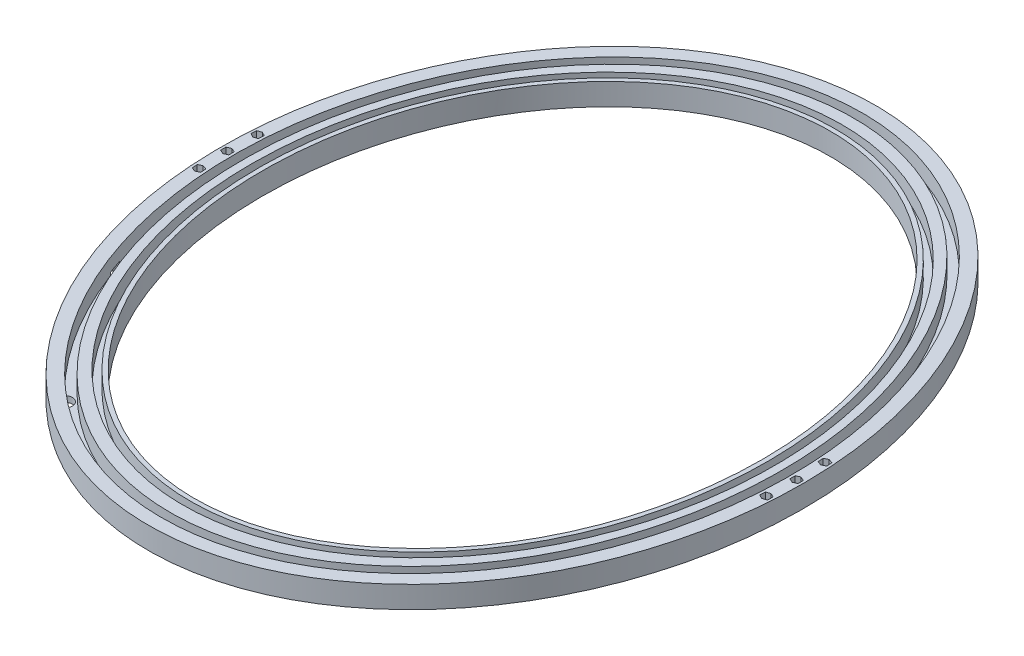
from build123d import *

# Parameters (mm, degrees)
BOSS_EXTRUDE1_DEPTH = 4
BOSS_EXTRUDE2_DEPTH = 11
BOSS_EXTRUDE3_DEPTH = 11
BOSS_EXTRUDE4_DEPTH = 11
SKETCH6_R           = 306.279665697
CUT_EXTRUDE1_DEPTH  = 652.769016328
CUT_EXTRUDE2_REACH  = 647.465
SKETCH7_R           = 1.6
CUT_EXTRUDE3_DEPTH  = 6
SKETCH10_R          = 5.05
SKETCH10_R_2        = 5.1
CUT_EXTRUDE5_DEPTH  = 6


# Read off the part's stored shape, not the designer's step: Boss-Extrude2, Boss-Extrude3, Boss-Extrude4
with BuildPart() as part:
    # Sketch1 → Boss-Extrude1 (new body)
    with BuildSketch(Plane(origin=(0, 0, 0), x_dir=(1, 0, 0), z_dir=(0, 1, 0))):
        with BuildLine():
            add(Edge.make_bspline(
                [(194.620385804, -441.419310901), (196.467552441, -434.101473588), (198.027915319, -426.761109931), (200.605339766, -412.03771026), (201.622280103, -404.654664724), (203.128308568, -389.84711471), (203.617238499, -382.422597806), (204.069983835, -367.53232008), (204.033621448, -360.066545294), (203.577995162, -348.836380993), (203.359198339, -345.087736705), (202.928541561, -339.456722665), (202.767716017, -337.576445109), (202.412736876, -333.825137098), (202.218627329, -331.953928435), (201.165418973, -322.619994341), (200.058567787, -315.223535194), (197.320407538, -300.570893555), (195.688759817, -293.314801644), (191.892155974, -278.945261725), (189.726808976, -271.831918264), (184.840221992, -257.753915941), (182.118548397, -250.789373057), (178.344586975, -242.1831583), (177.571144769, -240.46690364), (175.986063738, -237.044610763), (175.173814067, -235.337420367), (172.690170271, -230.255040073), (170.968765927, -226.91179678), (165.605993946, -217.018217693), (161.766145757, -210.603978938), (153.536413796, -198.152657844), (149.14605933, -192.115898256), (142.119078567, -183.363458105), (139.702923595, -180.496601548), (135.962459089, -176.276016398), (134.696262911, -174.882439791), (132.124171998, -172.122507664), (130.816728793, -170.7545379), (124.196475055, -164.00397451), (118.665001651, -158.919458682), (107.116946928, -149.401858335), (101.100125047, -144.969096856), (91.686503415, -138.84150587), (88.483715508, -136.886145902), (83.577283087, -134.090413986), (81.924760803, -133.181392117), (78.58477376, -131.410271179), (76.894310502, -130.546715382), (68.40765527, -126.376520843), (61.486962452, -123.498248539), (47.381935605, -118.660621272), (40.197390572, -116.702001765), (29.214824331, -114.481206365), (25.519614639, -113.860682535), (19.923285392, -113.116421475), (18.048921554, -112.899427611), (14.282000828, -112.528851477), (12.386853807, -112.375207005), (2.943822558, -111.772747758), (-4.561349604, -111.81386609), (-19.476819147, -112.903712603), (-26.887110104, -113.952509017), (-36.0906528, -115.89351835), (-37.928396665, -116.313206298), (-41.597902671, -117.216110596), (-43.432512164, -117.700145622), (-48.906557548, -119.242513666), (-52.503187642, -120.386926108), (-63.142104158, -124.152744865), (-70.033721575, -127.106061252), (-80.086338788, -132.16344388), (-83.38973003, -133.953834759), (-88.274472383, -136.794383613), (-89.8909864, -137.767080916), (-93.100664294, -139.76391375), (-94.696084981, -140.789570422), (-102.584272221, -146.025099561), (-108.599715711, -150.546133915), (-120.091766429, -160.195519005), (-125.568498169, -165.323729405), (-133.401556714, -173.446637001), (-135.949011734, -176.225915704), (-139.676074198, -180.500915443), (-140.903600163, -181.944720765), (-143.316747392, -184.854313097), (-144.503630569, -186.321492507), (-150.342181848, -193.717678454), (-154.707109923, -199.827014735), (-162.870046898, -212.402220676), (-166.668193485, -218.868003744), (-171.959563903, -228.821915575), (-173.655802044, -232.182369388), (-176.914507707, -238.987404863), (-178.478951468, -242.437228748), (-182.942142836, -252.835854924), (-185.621678632, -259.853075878), (-190.423917009, -274.047089934), (-192.546636661, -281.223878145), (-196.25454701, -295.73149468), (-197.839772593, -303.062313005), (-199.81840743, -314.172940579), (-200.411486249, -317.895530355), (-201.463741597, -325.379082398), (-201.920382234, -329.122419285), (-203.085224325, -340.344094507), (-203.589361822, -347.819821968), (-204.067010292, -362.760779522), (-204.014114332, -377.691241332), (-202.90325555, -392.600773496), (-201.665177232, -403.774911816), (-201.184962805, -407.498288811), (-200.361097468, -413.081305902), (-200.069217385, -414.941970178), (-199.450551083, -418.662608184), (-199.123418408, -420.524427594), (-197.404009619, -429.807631957), (-195.764078337, -437.134767595), (-191.958805524, -451.591461062), (-189.793106181, -458.720884337), (-184.926292394, -472.778390805), (-182.224796158, -479.706330427), (-176.26189126, -493.351657495), (-173.000363523, -500.069000165), (-167.656974391, -509.975381275), (-165.800496514, -513.249174023), (-162.896992941, -518.115193999), (-161.908010471, -519.731864914), (-159.897414113, -522.937328153), (-158.875906631, -524.526117637), (-153.686964061, -532.400045892), (-149.275038307, -538.474890479), (-139.910897933, -550.159860045), (-134.958027849, -555.769421238), (-124.473407568, -566.49063046), (-118.940036671, -571.603574283), (-107.238503072, -581.272636903), (-101.173705192, -585.741675668), (-88.605167995, -593.930189986), (-82.100856122, -597.648687809), (-71.993777922, -602.627710825), (-68.566160829, -604.18733155), (-63.332753332, -606.369688795), (-61.5729417, -607.070941478), (-58.021799704, -608.419623532), (-56.23633682, -609.064732819), (-47.292324383, -612.13308112), (-40.051288958, -614.096876102), (-25.398096607, -617.045726954), (-17.985877543, -618.030427429), (-6.734669887, -618.747468839), (-2.962096985, -618.859678072), (2.731230486, -618.830849573), (4.635046517, -618.788187569), (8.422374646, -618.637897418), (10.309887144, -618.530300973), (19.717265304, -617.833087307), (27.146562833, -616.765695878), (41.819162528, -613.649731395), (49.062452483, -611.601093923), (58.000401691, -608.427500988), (59.783210082, -607.761602722), (63.312735793, -606.378119207), (65.062498496, -605.659487304), (70.267768927, -603.424682945), (73.67926762, -601.829617337), (83.745242392, -596.742319418), (90.231395052, -592.94834076), (99.640906984, -586.684229391), (102.724071122, -584.500572172), (107.269625001, -581.08312157), (108.77240484, -579.919545038), (111.735637094, -577.55837127), (113.198115562, -576.359298822), (120.417597811, -570.2741923), (125.896526337, -565.119558083), (136.306354287, -554.280934046), (141.237532913, -548.597213912), (147.075394683, -541.177564128), (148.226637265, -539.677860819), (150.496729819, -536.647165333), (151.616557098, -535.114698162), (154.914434913, -530.489258101), (157.034278407, -527.364011852), (163.168753408, -517.869318293), (166.958804006, -511.381167011), (173.977476944, -498.108117209), (178.820704258, -487.930924721), (183.056099177, -477.43245773), (185.073116719, -472.130009087), (185.729060142, -470.352540207), (187.00513834, -466.786516032), (187.625290776, -464.998004254), (189.432851762, -459.616204661), (191.13465706, -454.20188791), (192.937773905, -447.829125494), (193.794094126, -444.6288347), (194.151431243, -443.254312143), (194.387513999, -442.337305164), (194.504937889, -441.876675733), (194.620385804, -441.419310901)],
                knots=[0, 0, 0, 0, 0.015625, 0.015625, 0.03125, 0.03125, 0.046875, 0.046875, 0.0625, 0.0625, 0.0703125, 0.0703125, 0.07421875, 0.07421875, 0.078125, 0.078125, 0.09375, 0.09375, 0.109375, 0.109375, 0.125, 0.125, 0.140625, 0.140625, 0.14453125, 0.14453125, 0.1484375, 0.1484375, 0.15625, 0.15625, 0.171875, 0.171875, 0.1875, 0.1875, 0.1953125, 0.1953125, 0.19921875, 0.19921875, 0.203125, 0.203125, 0.21875, 0.21875, 0.234375, 0.234375, 0.2421875, 0.2421875, 0.24609375, 0.24609375, 0.25, 0.25, 0.265625, 0.265625, 0.28125, 0.28125, 0.2890625, 0.2890625, 0.29296875, 0.29296875, 0.296875, 0.296875, 0.3125, 0.3125, 0.328125, 0.328125, 0.33203125, 0.33203125, 0.3359375, 0.3359375, 0.34375, 0.34375, 0.359375, 0.359375, 0.3671875, 0.3671875, 0.37109375, 0.37109375, 0.375, 0.375, 0.390625, 0.390625, 0.40625, 0.40625, 0.4140625, 0.4140625, 0.41796875, 0.41796875, 0.421875, 0.421875, 0.4375, 0.4375, 0.453125, 0.453125, 0.4609375, 0.4609375, 0.46875, 0.46875, 0.484375, 0.484375, 0.5, 0.5, 0.515625, 0.515625, 0.5234375, 0.5234375, 0.53125, 0.53125, 0.546875, 0.546875, 0.5625, 0.578125, 0.578125, 0.5859375, 0.5859375, 0.58984375, 0.58984375, 0.59375, 0.59375, 0.609375, 0.609375, 0.625, 0.625, 0.640625, 0.640625, 0.65625, 0.65625, 0.6640625, 0.6640625, 0.66796875, 0.66796875, 0.671875, 0.671875, 0.6875, 0.6875, 0.703125, 0.703125, 0.71875, 0.71875, 0.734375, 0.734375, 0.75, 0.75, 0.7578125, 0.7578125, 0.76171875, 0.76171875, 0.765625, 0.765625, 0.78125, 0.78125, 0.796875, 0.796875, 0.8046875, 0.8046875, 0.80859375, 0.80859375, 0.8125, 0.8125, 0.828125, 0.828125, 0.84375, 0.84375, 0.84765625, 0.84765625, 0.8515625, 0.8515625, 0.859375, 0.859375, 0.875, 0.875, 0.8828125, 0.8828125, 0.88671875, 0.88671875, 0.890625, 0.890625, 0.90625, 0.90625, 0.921875, 0.921875, 0.92578125, 0.92578125, 0.9296875, 0.9296875, 0.9375, 0.9375, 0.953125, 0.953125, 0.96875, 0.9765625, 0.9765625, 0.98046875, 0.98046875, 0.984375, 0.984375, 0.9921875, 0.99609375, 0.998046875, 0.999023438, 0.999023438, 1, 1, 1, 1], degree=3))
        make_face()
        with BuildLine():
            add(Edge.make_bspline(
                [(163.032386426, -429.803444684), (164.56353133, -423.58288692), (165.857592299, -417.345215032), (167.997031611, -404.837482685), (168.842248863, -398.567410597), (170.097042437, -385.995819276), (170.50643246, -379.694286595), (170.892420854, -367.059979766), (170.868900659, -360.727197059), (170.503678217, -351.204205819), (170.326933568, -348.025904903), (169.977669104, -343.252379263), (169.847222592, -341.660191641), (169.558002729, -338.473771597), (169.399284244, -336.880518253), (168.538021795, -328.94054444), (167.630505344, -322.648822006), (165.382200691, -310.184858669), (164.041460053, -304.01260465), (160.920334434, -291.789335484), (159.140106288, -285.738277089), (155.122684013, -273.762175886), (152.885773908, -267.837054756), (149.164913593, -259.050164124), (147.863769032, -256.137983077), (145.816332471, -251.796107732), (145.117072389, -250.351599047), (143.691626478, -247.483020394), (142.965181, -246.05830327), (139.264157812, -238.98270645), (136.083527343, -233.475559716), (129.265248872, -222.780060741), (125.627852637, -217.591532879), (117.865572794, -207.55452601), (113.740619653, -202.706095507), (108.247836996, -196.880347999), (107.131333826, -195.72581296), (104.868635117, -193.446156563), (103.724770696, -192.323341683), (100.255272934, -189.006425438), (97.891726513, -186.863864136), (90.646880262, -180.645813363), (85.611943663, -176.779181854), (75.102987622, -169.642819878), (69.629402846, -166.372498514), (62.482838815, -162.698655226), (61.03815966, -161.984673019), (58.140294853, -160.610058103), (56.68434899, -159.947954959), (52.29548981, -158.037190949), (49.341547153, -156.864103354), (40.395256871, -153.648373303), (34.31847625, -151.909158234), (25.027533646, -149.932007383), (21.901291248, -149.378114443), (17.166226609, -148.71151115), (15.580253673, -148.51668711), (12.392760358, -148.182911972), (10.790015556, -148.043878326), (2.749491742, -147.492109169), (-3.633290322, -147.517586259), (-16.30391429, -148.461560829), (-22.591712571, -149.38046862), (-30.392535771, -151.083356854), (-31.949756077, -151.451629321), (-35.058257428, -152.244039762), (-36.611288352, -152.668686605), (-41.249760364, -154.023615234), (-44.294611318, -155.028729489), (-53.294131002, -158.333771963), (-59.113912443, -160.923086905), (-67.591165591, -165.348598192), (-70.374812082, -166.914099597), (-74.488046003, -169.395872202), (-75.84875196, -170.245381827), (-78.549585328, -171.988550216), (-79.890306731, -172.882710595), (-86.504883526, -177.435850191), (-91.542960465, -181.36140497), (-101.159646235, -189.725358489), (-105.737655228, -194.16442675), (-111.190030225, -200.014779721), (-112.2669815, -201.199945073), (-114.394018768, -203.600261968), (-115.444960431, -204.816431038), (-118.552002468, -208.502689453), (-120.554355292, -211.000812994), (-126.366639926, -218.609826111), (-129.981676529, -223.835429614), (-136.734965905, -234.567268184), (-139.872843534, -240.073724057), (-145.697138617, -251.352362042), (-148.383302886, -257.124693178), (-151.466356605, -264.50176508), (-152.069235058, -265.985262188), (-153.247534392, -268.968417737), (-153.822207209, -270.466252011), (-155.499153111, -274.967032958), (-156.556152378, -277.981765095), (-159.550791121, -287.067072655), (-161.312036396, -293.178767422), (-164.385346731, -305.506865585), (-165.697375115, -311.723277531), (-167.881545136, -324.258643649), (-168.753753533, -330.577582258), (-169.568420556, -338.540499255), (-169.717690251, -340.137702908), (-169.987810573, -343.33000604), (-170.350473639, -348.115463982), (-170.58677314, -352.892015438), (-170.89396607, -362.43346003), (-170.878300913, -368.778884372), (-170.411847081, -381.439064236), (-169.961216906, -387.753830929), (-168.620797269, -400.352411041), (-167.731237875, -406.636240676), (-166.056664372, -416.038004378), (-165.441829967, -419.167933225), (-164.432108883, -423.856661383), (-164.08095411, -425.418543051), (-163.349050917, -428.540220536), (-162.968775621, -430.097882123), (-161.000973109, -437.849539044), (-159.20970729, -443.953776869), (-155.190619467, -455.966954866), (-152.963103363, -461.876031885), (-148.05848393, -473.493058705), (-145.38186195, -479.201223843), (-139.553515975, -490.405012612), (-136.402373799, -495.900896527), (-131.288205066, -503.971390426), (-129.518951368, -506.632686584), (-126.762451472, -510.578723057), (-125.825195524, -511.888149561), (-123.924545929, -514.478910397), (-122.960721287, -515.760958402), (-118.073752284, -522.104194084), (-113.94764176, -526.964932873), (-105.239067166, -536.235716795), (-100.65747448, -540.646622506), (-93.414196402, -546.896691948), (-90.937988974, -548.919033267), (-87.125369363, -551.855456038), (-85.838097995, -552.818068842), (-83.229726839, -554.709885583), (-81.911923242, -555.63663093), (-75.276307195, -560.158596224), (-69.797846492, -563.434938071), (-58.485399616, -569.273862762), (-52.652136621, -571.837897471), (-45.120730785, -574.561459892), (-43.602444431, -575.082070557), (-40.541208771, -576.073778126), (-38.995041583, -576.545722982), (-34.348954062, -577.8764051), (-31.23958007, -578.651173365), (-21.875982434, -580.642837642), (-15.586374846, -581.527953122), (-2.911809857, -582.404128536), (3.473118175, -582.395463837), (11.516694719, -581.799379361), (13.125663399, -581.651028185), (16.323258887, -581.298419845), (17.914915949, -581.093958625), (22.668820067, -580.397503565), (25.810002482, -579.822447892), (35.152040082, -577.77587306), (41.27152522, -575.98349654), (48.789076682, -573.223294208), (50.285997398, -572.645269809), (53.26663298, -571.43714786), (54.752715147, -570.805974083), (59.17267784, -568.842459682), (62.062600758, -567.443130172), (70.571842361, -562.98951603), (76.030653893, -559.679637632), (83.921545075, -554.241353897), (86.502173046, -552.349498919), (90.300060603, -549.395383638), (91.553844835, -548.391285674), (94.037321697, -546.344725954), (95.268199196, -545.3011745), (101.333459302, -540.015076248), (105.92036428, -535.55153226), (114.613179795, -526.198996022), (118.718954448, -521.309883581), (124.539010881, -513.676712202), (126.422520709, -511.082338527), (129.164386323, -507.117009981), (130.065374316, -505.781537684), (131.834174739, -503.09490315), (132.702090712, -501.743670864), (136.961465581, -494.948998463), (140.112168222, -489.389957602), (145.938101711, -478.04357488), (148.613140882, -472.256140984), (153.509733333, -460.463528872), (155.730918351, -454.458173832), (158.729757476, -445.290278646), (159.671363331, -442.214868035), (160.996403065, -437.578978438), (161.423625767, -436.02956894), (162.042975925, -433.699342689), (162.245838293, -432.921579936), (162.5447967, -431.753417999), (162.643559763, -431.363777562), (162.839307601, -430.58399078), (162.93668987, -430.192229544), (163.032386426, -429.803444684)],
                knots=[0, 0, 0, 0, 0.015625, 0.015625, 0.03125, 0.03125, 0.046875, 0.046875, 0.0625, 0.0625, 0.0703125, 0.0703125, 0.07421875, 0.07421875, 0.078125, 0.078125, 0.09375, 0.09375, 0.109375, 0.109375, 0.125, 0.125, 0.140625, 0.140625, 0.1484375, 0.1484375, 0.15234375, 0.15234375, 0.15625, 0.15625, 0.171875, 0.171875, 0.1875, 0.1875, 0.203125, 0.203125, 0.20703125, 0.20703125, 0.2109375, 0.2109375, 0.21875, 0.21875, 0.234375, 0.234375, 0.25, 0.25, 0.25390625, 0.25390625, 0.2578125, 0.2578125, 0.265625, 0.265625, 0.28125, 0.28125, 0.2890625, 0.2890625, 0.29296875, 0.29296875, 0.296875, 0.296875, 0.3125, 0.3125, 0.328125, 0.328125, 0.33203125, 0.33203125, 0.3359375, 0.3359375, 0.34375, 0.34375, 0.359375, 0.359375, 0.3671875, 0.3671875, 0.37109375, 0.37109375, 0.375, 0.375, 0.390625, 0.390625, 0.40625, 0.40625, 0.41015625, 0.41015625, 0.4140625, 0.4140625, 0.421875, 0.421875, 0.4375, 0.4375, 0.453125, 0.453125, 0.46875, 0.46875, 0.47265625, 0.47265625, 0.4765625, 0.4765625, 0.484375, 0.484375, 0.5, 0.5, 0.515625, 0.515625, 0.53125, 0.53125, 0.53515625, 0.53515625, 0.5390625, 0.546875, 0.546875, 0.5625, 0.5625, 0.578125, 0.578125, 0.59375, 0.59375, 0.6015625, 0.6015625, 0.60546875, 0.60546875, 0.609375, 0.609375, 0.625, 0.625, 0.640625, 0.640625, 0.65625, 0.65625, 0.671875, 0.671875, 0.6796875, 0.6796875, 0.68359375, 0.68359375, 0.6875, 0.6875, 0.703125, 0.703125, 0.71875, 0.71875, 0.7265625, 0.7265625, 0.73046875, 0.73046875, 0.734375, 0.734375, 0.75, 0.75, 0.765625, 0.765625, 0.76953125, 0.76953125, 0.7734375, 0.7734375, 0.78125, 0.78125, 0.796875, 0.796875, 0.8125, 0.8125, 0.81640625, 0.81640625, 0.8203125, 0.8203125, 0.828125, 0.828125, 0.84375, 0.84375, 0.84765625, 0.84765625, 0.8515625, 0.8515625, 0.859375, 0.859375, 0.875, 0.875, 0.8828125, 0.8828125, 0.88671875, 0.88671875, 0.890625, 0.890625, 0.90625, 0.90625, 0.921875, 0.921875, 0.9296875, 0.9296875, 0.93359375, 0.93359375, 0.9375, 0.9375, 0.953125, 0.953125, 0.96875, 0.96875, 0.984375, 0.984375, 0.9921875, 0.9921875, 0.99609375, 0.99609375, 0.998046875, 0.998046875, 0.999023438, 0.999023438, 1, 1, 1, 1], degree=3))
        make_face(mode=Mode.SUBTRACT)
    extrude(amount=BOSS_EXTRUDE1_DEPTH)

    # Boss-Extrude2 outline → Boss-Extrude2 (add)
    with BuildSketch(Plane(origin=(0, 4, 0), x_dir=(1, 0, 0), z_dir=(0, 1, 0))):
        with BuildLine():
            add(Edge.make_bspline(
                [(194.620385804, -441.419310901), (196.467552441, -434.101473588), (198.027915319, -426.761109931), (200.605339766, -412.03771026), (201.622280103, -404.654664724), (203.128308568, -389.84711471), (203.617238499, -382.422597806), (204.069983835, -367.53232008), (204.033621448, -360.066545294), (203.577995162, -348.836380993), (203.359198339, -345.087736705), (202.928541561, -339.456722665), (202.767716017, -337.576445109), (202.412736876, -333.825137098), (202.218627329, -331.953928435), (201.165418973, -322.619994341), (200.058567787, -315.223535194), (197.320407538, -300.570893555), (195.688759817, -293.314801644), (191.892155974, -278.945261725), (189.726808976, -271.831918264), (184.840221992, -257.753915941), (182.118548397, -250.789373057), (178.344586975, -242.1831583), (177.571144769, -240.46690364), (175.986063738, -237.044610763), (175.173814067, -235.337420367), (172.690170271, -230.255040073), (170.968765927, -226.91179678), (165.605993946, -217.018217693), (161.766145757, -210.603978938), (153.536413796, -198.152657844), (149.14605933, -192.115898256), (142.119078567, -183.363458105), (139.702923595, -180.496601548), (135.962459089, -176.276016398), (134.696262911, -174.882439791), (132.124171998, -172.122507664), (130.816728793, -170.7545379), (124.196475055, -164.00397451), (118.665001651, -158.919458682), (107.116946928, -149.401858335), (101.100125047, -144.969096856), (91.686503415, -138.84150587), (88.483715508, -136.886145902), (83.577283087, -134.090413986), (81.924760803, -133.181392117), (78.58477376, -131.410271179), (76.894310502, -130.546715382), (68.40765527, -126.376520843), (61.486962452, -123.498248539), (47.381935605, -118.660621272), (40.197390572, -116.702001765), (29.214824331, -114.481206365), (25.519614639, -113.860682535), (19.923285392, -113.116421475), (18.048921554, -112.899427611), (14.282000828, -112.528851477), (12.386853807, -112.375207005), (2.943822558, -111.772747758), (-4.561349604, -111.81386609), (-19.476819147, -112.903712603), (-26.887110104, -113.952509017), (-36.0906528, -115.89351835), (-37.928396665, -116.313206298), (-41.597902671, -117.216110596), (-43.432512164, -117.700145622), (-48.906557548, -119.242513666), (-52.503187642, -120.386926108), (-63.142104158, -124.152744865), (-70.033721575, -127.106061252), (-80.086338788, -132.16344388), (-83.38973003, -133.953834759), (-88.274472383, -136.794383613), (-89.8909864, -137.767080916), (-93.100664294, -139.76391375), (-94.696084981, -140.789570422), (-102.584272221, -146.025099561), (-108.599715711, -150.546133915), (-120.091766429, -160.195519005), (-125.568498169, -165.323729405), (-133.401556714, -173.446637001), (-135.949011734, -176.225915704), (-139.676074198, -180.500915443), (-140.903600163, -181.944720765), (-143.316747392, -184.854313097), (-144.503630569, -186.321492507), (-150.342181848, -193.717678454), (-154.707109923, -199.827014735), (-162.870046898, -212.402220676), (-166.668193485, -218.868003744), (-171.959563903, -228.821915575), (-173.655802044, -232.182369388), (-176.914507707, -238.987404863), (-178.478951468, -242.437228748), (-182.942142836, -252.835854924), (-185.621678632, -259.853075878), (-190.423917009, -274.047089934), (-192.546636661, -281.223878145), (-196.25454701, -295.73149468), (-197.839772593, -303.062313005), (-199.81840743, -314.172940579), (-200.411486249, -317.895530355), (-201.463741597, -325.379082398), (-201.920382234, -329.122419285), (-203.085224325, -340.344094507), (-203.589361822, -347.819821968), (-204.067010292, -362.760779522), (-204.014114332, -377.691241332), (-202.90325555, -392.600773496), (-201.665177232, -403.774911816), (-201.184962805, -407.498288811), (-200.361097468, -413.081305902), (-200.069217385, -414.941970178), (-199.450551083, -418.662608184), (-199.123418408, -420.524427594), (-197.404009619, -429.807631957), (-195.764078337, -437.134767595), (-191.958805524, -451.591461062), (-189.793106181, -458.720884337), (-184.926292394, -472.778390805), (-182.224796158, -479.706330427), (-176.26189126, -493.351657495), (-173.000363523, -500.069000165), (-167.656974391, -509.975381275), (-165.800496514, -513.249174023), (-162.896992941, -518.115193999), (-161.908010471, -519.731864914), (-159.897414113, -522.937328153), (-158.875906631, -524.526117637), (-153.686964061, -532.400045892), (-149.275038307, -538.474890479), (-139.910897933, -550.159860045), (-134.958027849, -555.769421238), (-124.473407568, -566.49063046), (-118.940036671, -571.603574283), (-107.238503072, -581.272636903), (-101.173705192, -585.741675668), (-88.605167995, -593.930189986), (-82.100856122, -597.648687809), (-71.993777922, -602.627710825), (-68.566160829, -604.18733155), (-63.332753332, -606.369688795), (-61.5729417, -607.070941478), (-58.021799704, -608.419623532), (-56.23633682, -609.064732819), (-47.292324383, -612.13308112), (-40.051288958, -614.096876102), (-25.398096607, -617.045726954), (-17.985877543, -618.030427429), (-6.734669887, -618.747468839), (-2.962096985, -618.859678072), (2.731230486, -618.830849573), (4.635046517, -618.788187569), (8.422374646, -618.637897418), (10.309887144, -618.530300973), (19.717265304, -617.833087307), (27.146562833, -616.765695878), (41.819162528, -613.649731395), (49.062452483, -611.601093923), (58.000401691, -608.427500988), (59.783210082, -607.761602722), (63.312735793, -606.378119207), (65.062498496, -605.659487304), (70.267768927, -603.424682945), (73.67926762, -601.829617337), (83.745242392, -596.742319418), (90.231395052, -592.94834076), (99.640906984, -586.684229391), (102.724071122, -584.500572172), (107.269625001, -581.08312157), (108.77240484, -579.919545038), (111.735637094, -577.55837127), (113.198115562, -576.359298822), (120.417597811, -570.2741923), (125.896526337, -565.119558083), (136.306354287, -554.280934046), (141.237532913, -548.597213912), (147.075394683, -541.177564128), (148.226637265, -539.677860819), (150.496729819, -536.647165333), (151.616557098, -535.114698162), (154.914434913, -530.489258101), (157.034278407, -527.364011852), (163.168753408, -517.869318293), (166.958804006, -511.381167011), (173.977476944, -498.108117209), (178.820704258, -487.930924721), (183.056099177, -477.43245773), (185.073116719, -472.130009087), (185.729060142, -470.352540207), (187.00513834, -466.786516032), (187.625290776, -464.998004254), (189.432851762, -459.616204661), (191.13465706, -454.20188791), (192.937773905, -447.829125494), (193.794094126, -444.6288347), (194.151431243, -443.254312143), (194.387513999, -442.337305164), (194.504937889, -441.876675733), (194.620385804, -441.419310901)],
                knots=[0, 0, 0, 0, 0.015625, 0.015625, 0.03125, 0.03125, 0.046875, 0.046875, 0.0625, 0.0625, 0.0703125, 0.0703125, 0.07421875, 0.07421875, 0.078125, 0.078125, 0.09375, 0.09375, 0.109375, 0.109375, 0.125, 0.125, 0.140625, 0.140625, 0.14453125, 0.14453125, 0.1484375, 0.1484375, 0.15625, 0.15625, 0.171875, 0.171875, 0.1875, 0.1875, 0.1953125, 0.1953125, 0.19921875, 0.19921875, 0.203125, 0.203125, 0.21875, 0.21875, 0.234375, 0.234375, 0.2421875, 0.2421875, 0.24609375, 0.24609375, 0.25, 0.25, 0.265625, 0.265625, 0.28125, 0.28125, 0.2890625, 0.2890625, 0.29296875, 0.29296875, 0.296875, 0.296875, 0.3125, 0.3125, 0.328125, 0.328125, 0.33203125, 0.33203125, 0.3359375, 0.3359375, 0.34375, 0.34375, 0.359375, 0.359375, 0.3671875, 0.3671875, 0.37109375, 0.37109375, 0.375, 0.375, 0.390625, 0.390625, 0.40625, 0.40625, 0.4140625, 0.4140625, 0.41796875, 0.41796875, 0.421875, 0.421875, 0.4375, 0.4375, 0.453125, 0.453125, 0.4609375, 0.4609375, 0.46875, 0.46875, 0.484375, 0.484375, 0.5, 0.5, 0.515625, 0.515625, 0.5234375, 0.5234375, 0.53125, 0.53125, 0.546875, 0.546875, 0.5625, 0.578125, 0.578125, 0.5859375, 0.5859375, 0.58984375, 0.58984375, 0.59375, 0.59375, 0.609375, 0.609375, 0.625, 0.625, 0.640625, 0.640625, 0.65625, 0.65625, 0.6640625, 0.6640625, 0.66796875, 0.66796875, 0.671875, 0.671875, 0.6875, 0.6875, 0.703125, 0.703125, 0.71875, 0.71875, 0.734375, 0.734375, 0.75, 0.75, 0.7578125, 0.7578125, 0.76171875, 0.76171875, 0.765625, 0.765625, 0.78125, 0.78125, 0.796875, 0.796875, 0.8046875, 0.8046875, 0.80859375, 0.80859375, 0.8125, 0.8125, 0.828125, 0.828125, 0.84375, 0.84375, 0.84765625, 0.84765625, 0.8515625, 0.8515625, 0.859375, 0.859375, 0.875, 0.875, 0.8828125, 0.8828125, 0.88671875, 0.88671875, 0.890625, 0.890625, 0.90625, 0.90625, 0.921875, 0.921875, 0.92578125, 0.92578125, 0.9296875, 0.9296875, 0.9375, 0.9375, 0.953125, 0.953125, 0.96875, 0.9765625, 0.9765625, 0.98046875, 0.98046875, 0.984375, 0.984375, 0.9921875, 0.99609375, 0.998046875, 0.999023438, 0.999023438, 1, 1, 1, 1], degree=3))
        make_face()
        with BuildLine():
            add(Edge.make_bspline(
                [(-181.272277335, -293.671400949), (-182.984740605, -300.547031018), (-185.871267247, -314.305951592), (-188.707541662, -335.08001051), (-190.084118967, -355.954539098), (-190.024549385, -373.443601123), (-189.24094184, -387.484572873), (-187.953712874, -401.581698517), (-185.430213349, -418.941266876), (-180.954311492, -439.383130138), (-175.003788198, -459.428764256), (-167.5345286, -479.042103457), (-158.387004597, -498.279321367), (-147.768924844, -516.474469623), (-135.625255695, -533.621114428), (-124.138058836, -546.979972059), (-114.060609032, -557.024682003), (-103.564751359, -566.432938725), (-92.372651787, -574.930880799), (-80.46077519, -582.437908825), (-71.119409202, -587.561980605), (-61.456190649, -592.095568346), (-48.36896052, -597.23594868), (-34.886831897, -601.057387364), (-21.036516681, -603.494923659), (-10.400043887, -604.609927313), (0.265416015, -604.967279639), (14.348658547, -604.444425744), (31.76331834, -601.974737734), (52.418112914, -596.052023578), (68.559338909, -588.994490397), (80.926045216, -582.163631294), (89.952722255, -576.43455252), (98.585370956, -570.214593387), (109.550356738, -561.33072527), (122.295189187, -549.171583157), (136.179391982, -532.920312568), (148.315717309, -515.623948946), (157.119968201, -500.383391877), (163.409820505, -487.718237629), (169.197279374, -474.752474931), (175.392438463, -458.283233633), (181.29405953, -438.062465857), (185.708250417, -417.424344225), (188.647400596, -396.335003645), (190.068886514, -375.323466958), (190.030552451, -354.321221569), (188.780079346, -336.836751578), (187.035858308, -322.86871595), (184.777406402, -308.87403074), (181.028645165, -291.656948759), (175.080327205, -271.558737421), (167.647017647, -252.000509185), (160.158617636, -236.177096273), (153.3367696, -223.8288321), (145.917788238, -211.679921784), (135.741265083, -197.288115878), (124.292988616, -183.957305035), (114.323550169, -173.986838451), (106.405833344, -166.862639913), (98.074613807, -160.158135347), (86.585625014, -151.942319006), (74.447552521, -144.775233041), (61.64899543, -138.748043127), (48.323201982, -133.500185461), (31.331851838, -128.709690651), (13.927313357, -126.273120302), (-0.28783547, -125.792961322), (-14.594108215, -126.332038735), (-28.55468164, -128.353803462), (-42.263646934, -131.793155088), (-52.42950613, -135.089773423), (-62.379576024, -139.066444273), (-75.154001974, -145.156309821), (-90.329201536, -154.204085561), (-107.346261732, -167.284004279), (-122.624663975, -181.948401251), (-134.094946829, -195.416221117), (-142.537590815, -206.90376081), (-150.384649082, -218.682703136), (-159.162440153, -233.971389539), (-168.138421695, -253.141115263), (-174.374533967, -269.813469654), (-178.568982456, -283.359870954), (-180.4160457, -290.233585914), (-181.272277335, -293.671400949)],
                knots=[0, 0, 0, 0, 0.015625, 0.03125, 0.046875, 0.0625, 0.0703125, 0.078125, 0.09375, 0.109375, 0.125, 0.140625, 0.15625, 0.171875, 0.1875, 0.203125, 0.2109375, 0.21875, 0.234375, 0.2421875, 0.25, 0.2578125, 0.265625, 0.28125, 0.2890625, 0.296875, 0.3046875, 0.3125, 0.328125, 0.34375, 0.359375, 0.3671875, 0.375, 0.3828125, 0.390625, 0.40625, 0.421875, 0.4375, 0.453125, 0.4609375, 0.46875, 0.484375, 0.5, 0.515625, 0.53125, 0.546875, 0.5625, 0.578125, 0.5859375, 0.59375, 0.609375, 0.625, 0.640625, 0.65625, 0.6640625, 0.671875, 0.6875, 0.703125, 0.7109375, 0.71875, 0.7265625, 0.734375, 0.75, 0.7578125, 0.765625, 0.78125, 0.796875, 0.8046875, 0.8125, 0.828125, 0.8359375, 0.84375, 0.8515625, 0.859375, 0.875, 0.890625, 0.90625, 0.921875, 0.9296875, 0.9375, 0.953125, 0.96875, 0.984375, 0.9921875, 1, 1, 1, 1], degree=3))
        make_face(mode=Mode.SUBTRACT)
    extrude(amount=BOSS_EXTRUDE2_DEPTH)

    # Boss-Extrude3 outline → Boss-Extrude3 (add)
    with BuildSketch(Plane(origin=(0, 4, 0), x_dir=(1, 0, 0), z_dir=(0, 1, 0))):
        with BuildLine():
            add(Edge.make_bspline(
                [(-165.778947521, -298.694795463), (-166.565398695, -301.854239104), (-168.026911536, -308.222243223), (-170.468952654, -320.980481257), (-172.65975546, -337.047780263), (-173.932488917, -356.486597995), (-173.837269007, -376.104904207), (-172.382468985, -395.473205566), (-169.580457928, -414.661051115), (-165.412895471, -433.630369966), (-159.793537784, -452.438561149), (-152.810688583, -470.593982106), (-145.821284138, -485.193326428), (-139.493636255, -496.52254227), (-132.63374807, -507.640095785), (-123.17474059, -520.882188622), (-112.562809437, -533.098023619), (-103.324793633, -542.224074496), (-88.637769695, -555.25424923), (-72.510949182, -566.014799709), (-54.66406497, -574.212188746), (-42.548274704, -578.839107963), (-30.094985892, -582.222092375), (-17.285775414, -584.308996467), (-4.246636933, -585.491028617), (11.843332365, -585.220765094), (27.748662115, -582.725933418), (40.401881633, -579.360232503), (52.67998772, -575.178629579), (64.421149767, -569.839546919), (75.646650273, -563.420368411), (83.843531945, -558.051207329), (91.682677309, -552.232631607), (101.612661516, -543.958645566), (110.827503973, -534.930024489), (119.363993865, -525.207859704), (125.44713823, -517.558837117), (131.165338604, -509.62592856), (138.23001544, -498.820276434), (146.1106849, -484.84855405), (154.143154337, -467.412852297), (159.707867254, -452.342143763), (163.4935931, -439.979469583), (166.842684284, -427.376417425), (170.129454896, -411.521963553), (172.699363607, -392.384027714), (173.930826926, -373.123185263), (173.830694621, -353.755049516), (172.359701836, -334.233143888), (169.540505002, -315.050531036), (165.372402362, -296.153048325), (159.824179497, -277.57130008), (152.801052837, -259.289541803), (144.423412133, -241.803750326), (136.256742202, -227.866907495), (128.967258521, -217.135704004), (121.141862953, -206.691108146), (110.542258497, -194.477766665), (96.43079414, -181.194473261), (80.761047161, -169.406768046), (66.825362, -161.303712544), (55.09805631, -155.877830339), (45.962773658, -152.354497418), (36.680427345, -149.47198579), (24.15069773, -146.497175112), (11.397350035, -144.822382849), (-1.664603276, -144.512467296), (-14.571062083, -145.130139253), (-27.234480518, -147.082632395), (-39.662580935, -150.322959247), (-48.881264478, -153.403183848), (-57.933475602, -157.113481536), (-69.523479052, -162.761227864), (-80.522155615, -169.445032549), (-90.936593135, -177.084173473), (-101.005801145, -185.384184662), (-112.583614454, -196.638984115), (-125.006351486, -211.392228039), (-134.217277961, -224.66650898), (-140.919708532, -235.846305415), (-147.087325453, -247.217632073), (-153.873308064, -261.825391627), (-160.61468245, -279.934600959), (-164.206045173, -292.37590818), (-165.778947521, -298.694795463)],
                knots=[0, 0, 0, 0, 0.0078125, 0.015625, 0.03125, 0.046875, 0.0625, 0.078125, 0.09375, 0.109375, 0.125, 0.140625, 0.15625, 0.1640625, 0.171875, 0.1875, 0.203125, 0.2109375, 0.21875, 0.25, 0.2578125, 0.265625, 0.28125, 0.2890625, 0.296875, 0.3125, 0.328125, 0.3359375, 0.34375, 0.359375, 0.3671875, 0.375, 0.3828125, 0.390625, 0.40625, 0.4140625, 0.421875, 0.4296875, 0.4375, 0.453125, 0.46875, 0.484375, 0.4921875, 0.5, 0.515625, 0.53125, 0.546875, 0.5625, 0.578125, 0.59375, 0.609375, 0.625, 0.640625, 0.65625, 0.671875, 0.6796875, 0.6875, 0.703125, 0.71875, 0.734375, 0.75, 0.7578125, 0.765625, 0.7734375, 0.78125, 0.796875, 0.8046875, 0.8125, 0.828125, 0.8359375, 0.84375, 0.8515625, 0.859375, 0.875, 0.8828125, 0.890625, 0.90625, 0.921875, 0.9375, 0.9453125, 0.953125, 0.96875, 0.984375, 1, 1, 1, 1], degree=3))
        make_face()
        with BuildLine():
            add(Edge.make_bspline(
                [(163.032386426, -429.803444684), (164.56353133, -423.58288692), (165.857592299, -417.345215032), (167.997031611, -404.837482685), (168.842248863, -398.567410597), (170.097042437, -385.995819276), (170.50643246, -379.694286595), (170.892420854, -367.059979766), (170.868900659, -360.727197059), (170.503678217, -351.204205819), (170.326933568, -348.025904903), (169.977669104, -343.252379263), (169.847222592, -341.660191641), (169.558002729, -338.473771597), (169.399284244, -336.880518253), (168.538021795, -328.94054444), (167.630505344, -322.648822006), (165.382200691, -310.184858669), (164.041460053, -304.01260465), (160.920334434, -291.789335484), (159.140106288, -285.738277089), (155.122684013, -273.762175886), (152.885773908, -267.837054756), (149.164913593, -259.050164124), (147.863769032, -256.137983077), (145.816332471, -251.796107732), (145.117072389, -250.351599047), (143.691626478, -247.483020394), (142.965181, -246.05830327), (139.264157812, -238.98270645), (136.083527343, -233.475559716), (129.265248872, -222.780060741), (125.627852637, -217.591532879), (117.865572794, -207.55452601), (113.740619653, -202.706095507), (108.247836996, -196.880347999), (107.131333826, -195.72581296), (104.868635117, -193.446156563), (103.724770696, -192.323341683), (100.255272934, -189.006425438), (97.891726513, -186.863864136), (90.646880262, -180.645813363), (85.611943663, -176.779181854), (75.102987622, -169.642819878), (69.629402846, -166.372498514), (62.482838815, -162.698655226), (61.03815966, -161.984673019), (58.140294853, -160.610058103), (56.68434899, -159.947954959), (52.29548981, -158.037190949), (49.341547153, -156.864103354), (40.395256871, -153.648373303), (34.31847625, -151.909158234), (25.027533646, -149.932007383), (21.901291248, -149.378114443), (17.166226609, -148.71151115), (15.580253673, -148.51668711), (12.392760358, -148.182911972), (10.790015556, -148.043878326), (2.749491742, -147.492109169), (-3.633290322, -147.517586259), (-16.30391429, -148.461560829), (-22.591712571, -149.38046862), (-30.392535771, -151.083356854), (-31.949756077, -151.451629321), (-35.058257428, -152.244039762), (-36.611288352, -152.668686605), (-41.249760364, -154.023615234), (-44.294611318, -155.028729489), (-53.294131002, -158.333771963), (-59.113912443, -160.923086905), (-67.591165591, -165.348598192), (-70.374812082, -166.914099597), (-74.488046003, -169.395872202), (-75.84875196, -170.245381827), (-78.549585328, -171.988550216), (-79.890306731, -172.882710595), (-86.504883526, -177.435850191), (-91.542960465, -181.36140497), (-101.159646235, -189.725358489), (-105.737655228, -194.16442675), (-111.190030225, -200.014779721), (-112.2669815, -201.199945073), (-114.394018768, -203.600261968), (-115.444960431, -204.816431038), (-118.552002468, -208.502689453), (-120.554355292, -211.000812994), (-126.366639926, -218.609826111), (-129.981676529, -223.835429614), (-136.734965905, -234.567268184), (-139.872843534, -240.073724057), (-145.697138617, -251.352362042), (-148.383302886, -257.124693178), (-151.466356605, -264.50176508), (-152.069235058, -265.985262188), (-153.247534392, -268.968417737), (-153.822207209, -270.466252011), (-155.499153111, -274.967032958), (-156.556152378, -277.981765095), (-159.550791121, -287.067072655), (-161.312036396, -293.178767422), (-164.385346731, -305.506865585), (-165.697375115, -311.723277531), (-167.881545136, -324.258643649), (-168.753753533, -330.577582258), (-169.568420556, -338.540499255), (-169.717690251, -340.137702908), (-169.987810573, -343.33000604), (-170.350473639, -348.115463982), (-170.58677314, -352.892015438), (-170.89396607, -362.43346003), (-170.878300913, -368.778884372), (-170.411847081, -381.439064236), (-169.961216906, -387.753830929), (-168.620797269, -400.352411041), (-167.731237875, -406.636240676), (-166.056664372, -416.038004378), (-165.441829967, -419.167933225), (-164.432108883, -423.856661383), (-164.08095411, -425.418543051), (-163.349050917, -428.540220536), (-162.968775621, -430.097882123), (-161.000973109, -437.849539044), (-159.20970729, -443.953776869), (-155.190619467, -455.966954866), (-152.963103363, -461.876031885), (-148.05848393, -473.493058705), (-145.38186195, -479.201223843), (-139.553515975, -490.405012612), (-136.402373799, -495.900896527), (-131.288205066, -503.971390426), (-129.518951368, -506.632686584), (-126.762451472, -510.578723057), (-125.825195524, -511.888149561), (-123.924545929, -514.478910397), (-122.960721287, -515.760958402), (-118.073752284, -522.104194084), (-113.94764176, -526.964932873), (-105.239067166, -536.235716795), (-100.65747448, -540.646622506), (-93.414196402, -546.896691948), (-90.937988974, -548.919033267), (-87.125369363, -551.855456038), (-85.838097995, -552.818068842), (-83.229726839, -554.709885583), (-81.911923242, -555.63663093), (-75.276307195, -560.158596224), (-69.797846492, -563.434938071), (-58.485399616, -569.273862762), (-52.652136621, -571.837897471), (-45.120730785, -574.561459892), (-43.602444431, -575.082070557), (-40.541208771, -576.073778126), (-38.995041583, -576.545722982), (-34.348954062, -577.8764051), (-31.23958007, -578.651173365), (-21.875982434, -580.642837642), (-15.586374846, -581.527953122), (-2.911809857, -582.404128536), (3.473118175, -582.395463837), (11.516694719, -581.799379361), (13.125663399, -581.651028185), (16.323258887, -581.298419845), (17.914915949, -581.093958625), (22.668820067, -580.397503565), (25.810002482, -579.822447892), (35.152040082, -577.77587306), (41.27152522, -575.98349654), (48.789076682, -573.223294208), (50.285997398, -572.645269809), (53.26663298, -571.43714786), (54.752715147, -570.805974083), (59.17267784, -568.842459682), (62.062600758, -567.443130172), (70.571842361, -562.98951603), (76.030653893, -559.679637632), (83.921545075, -554.241353897), (86.502173046, -552.349498919), (90.300060603, -549.395383638), (91.553844835, -548.391285674), (94.037321697, -546.344725954), (95.268199196, -545.3011745), (101.333459302, -540.015076248), (105.92036428, -535.55153226), (114.613179795, -526.198996022), (118.718954448, -521.309883581), (124.539010881, -513.676712202), (126.422520709, -511.082338527), (129.164386323, -507.117009981), (130.065374316, -505.781537684), (131.834174739, -503.09490315), (132.702090712, -501.743670864), (136.961465581, -494.948998463), (140.112168222, -489.389957602), (145.938101711, -478.04357488), (148.613140882, -472.256140984), (153.509733333, -460.463528872), (155.730918351, -454.458173832), (158.729757476, -445.290278646), (159.671363331, -442.214868035), (160.996403065, -437.578978438), (161.423625767, -436.02956894), (162.042975925, -433.699342689), (162.245838293, -432.921579936), (162.5447967, -431.753417999), (162.643559763, -431.363777562), (162.839307601, -430.58399078), (162.93668987, -430.192229544), (163.032386426, -429.803444684)],
                knots=[0, 0, 0, 0, 0.015625, 0.015625, 0.03125, 0.03125, 0.046875, 0.046875, 0.0625, 0.0625, 0.0703125, 0.0703125, 0.07421875, 0.07421875, 0.078125, 0.078125, 0.09375, 0.09375, 0.109375, 0.109375, 0.125, 0.125, 0.140625, 0.140625, 0.1484375, 0.1484375, 0.15234375, 0.15234375, 0.15625, 0.15625, 0.171875, 0.171875, 0.1875, 0.1875, 0.203125, 0.203125, 0.20703125, 0.20703125, 0.2109375, 0.2109375, 0.21875, 0.21875, 0.234375, 0.234375, 0.25, 0.25, 0.25390625, 0.25390625, 0.2578125, 0.2578125, 0.265625, 0.265625, 0.28125, 0.28125, 0.2890625, 0.2890625, 0.29296875, 0.29296875, 0.296875, 0.296875, 0.3125, 0.3125, 0.328125, 0.328125, 0.33203125, 0.33203125, 0.3359375, 0.3359375, 0.34375, 0.34375, 0.359375, 0.359375, 0.3671875, 0.3671875, 0.37109375, 0.37109375, 0.375, 0.375, 0.390625, 0.390625, 0.40625, 0.40625, 0.41015625, 0.41015625, 0.4140625, 0.4140625, 0.421875, 0.421875, 0.4375, 0.4375, 0.453125, 0.453125, 0.46875, 0.46875, 0.47265625, 0.47265625, 0.4765625, 0.4765625, 0.484375, 0.484375, 0.5, 0.5, 0.515625, 0.515625, 0.53125, 0.53125, 0.53515625, 0.53515625, 0.5390625, 0.546875, 0.546875, 0.5625, 0.5625, 0.578125, 0.578125, 0.59375, 0.59375, 0.6015625, 0.6015625, 0.60546875, 0.60546875, 0.609375, 0.609375, 0.625, 0.625, 0.640625, 0.640625, 0.65625, 0.65625, 0.671875, 0.671875, 0.6796875, 0.6796875, 0.68359375, 0.68359375, 0.6875, 0.6875, 0.703125, 0.703125, 0.71875, 0.71875, 0.7265625, 0.7265625, 0.73046875, 0.73046875, 0.734375, 0.734375, 0.75, 0.75, 0.765625, 0.765625, 0.76953125, 0.76953125, 0.7734375, 0.7734375, 0.78125, 0.78125, 0.796875, 0.796875, 0.8125, 0.8125, 0.81640625, 0.81640625, 0.8203125, 0.8203125, 0.828125, 0.828125, 0.84375, 0.84375, 0.84765625, 0.84765625, 0.8515625, 0.8515625, 0.859375, 0.859375, 0.875, 0.875, 0.8828125, 0.8828125, 0.88671875, 0.88671875, 0.890625, 0.890625, 0.90625, 0.90625, 0.921875, 0.921875, 0.9296875, 0.9296875, 0.93359375, 0.93359375, 0.9375, 0.9375, 0.953125, 0.953125, 0.96875, 0.96875, 0.984375, 0.984375, 0.9921875, 0.9921875, 0.99609375, 0.99609375, 0.998046875, 0.998046875, 0.999023438, 0.999023438, 1, 1, 1, 1], degree=3))
        make_face(mode=Mode.SUBTRACT)
    extrude(amount=BOSS_EXTRUDE3_DEPTH)

    # Boss-Extrude4 outline → Boss-Extrude4 (add)
    with BuildSketch(Plane(origin=(0, 4, 0), x_dir=(1, 0, 0), z_dir=(0, 1, 0))):
        with BuildLine():
            add(Edge.make_bspline(
                [(175.228626798, -436.524448016), (176.07232537, -433.181234078), (177.641548752, -426.444060423), (180.270159301, -412.949055138), (182.644166086, -395.961024021), (183.823153805, -378.839218228), (184.049976884, -365.058519813), (183.791627161, -351.220470335), (182.568741865, -334.091867824), (179.677812451, -313.759914025), (176.065117236, -297.012444652), (172.428282842, -283.742056538), (168.268413967, -270.535364742), (162.168113581, -254.457630411), (153.375479703, -235.869218992), (144.759208887, -220.996585123), (137.026644446, -209.50118935), (128.82800145, -198.452471767), (119.892815805, -188.043432373), (110.183388493, -178.332384374), (102.474711186, -171.399442485), (94.398994618, -164.903800099), (83.233529353, -156.927917486), (68.483712066, -148.226674421), (49.346399093, -139.996279404), (32.899548914, -135.407375123), (19.395738605, -133.098928629), (9.043220793, -132.079160362), (-1.254365596, -131.803838612), (-14.878208658, -132.406924666), (-31.707629835, -134.927910773), (-51.697320552, -140.848595061), (-70.382818378, -149.224621257), (-85.053033769, -158.108694707), (-96.223560306, -166.306990312), (-106.800312955, -175.032039199), (-119.054595482, -186.932247118), (-130.085770391, -200.027554646), (-138.232150866, -211.225216109), (-145.789246953, -222.683370292), (-154.203911728, -237.476314959), (-162.776753118, -255.919132386), (-169.901652273, -275.014257747), (-174.667772679, -291.468452209), (-177.770526246, -304.926451213), (-180.362972987, -318.388852971), (-182.692009991, -335.295701061), (-184.065892277, -355.682965409), (-184.036311154, -372.760332574), (-183.296900354, -386.471449245), (-182.069036192, -400.227064349), (-179.643041246, -417.192750724), (-175.307859301, -437.226283408), (-170.481931681, -453.632782619), (-165.857983802, -466.580550237), (-160.706973232, -479.397028869), (-153.37996949, -494.881667483), (-144.806185329, -509.682481098), (-137.162682629, -521.067401471), (-128.943727915, -532.169273186), (-117.766311285, -545.205732373), (-105.389956836, -556.99480506), (-94.689683795, -565.638068658), (-83.463294569, -573.690362059), (-71.698624036, -580.643856759), (-59.330499324, -586.475640841), (-49.720578794, -590.266257871), (-39.864698799, -593.410571021), (-26.608482797, -596.660662912), (-9.748961962, -599.005123522), (11.055567661, -598.908996131), (31.188417775, -595.928667871), (47.527057899, -591.190771301), (60.360981605, -586.026460566), (72.706415141, -580.098077149), (84.388055822, -573.082495917), (95.439882542, -565.06127327), (103.436773519, -558.537604871), (111.081118573, -551.571488917), (120.683574905, -541.848998658), (131.704265481, -528.867995527), (143.449259979, -512.086338323), (153.782141097, -494.1186396), (162.478240581, -475.562535089), (169.693740318, -456.380748527), (173.541229654, -443.210875891), (175.228626798, -436.524448016)],
                knots=[0, 0, 0, 0, 0.0078125, 0.015625, 0.03125, 0.046875, 0.0546875, 0.0625, 0.078125, 0.09375, 0.109375, 0.1171875, 0.125, 0.140625, 0.15625, 0.171875, 0.1796875, 0.1875, 0.203125, 0.2109375, 0.21875, 0.2265625, 0.234375, 0.25, 0.265625, 0.28125, 0.2890625, 0.296875, 0.3046875, 0.3125, 0.328125, 0.34375, 0.359375, 0.375, 0.3828125, 0.390625, 0.40625, 0.421875, 0.4296875, 0.4375, 0.453125, 0.46875, 0.484375, 0.5, 0.5078125, 0.515625, 0.53125, 0.546875, 0.5625, 0.5703125, 0.578125, 0.59375, 0.609375, 0.625, 0.6328125, 0.640625, 0.65625, 0.671875, 0.6796875, 0.6875, 0.703125, 0.71875, 0.7265625, 0.734375, 0.75, 0.7578125, 0.765625, 0.7734375, 0.78125, 0.796875, 0.8125, 0.828125, 0.84375, 0.8515625, 0.859375, 0.875, 0.8828125, 0.890625, 0.8984375, 0.90625, 0.921875, 0.9375, 0.953125, 0.96875, 0.984375, 1, 1, 1, 1], degree=3))
        make_face()
        with BuildLine():
            add(Edge.make_bspline(
                [(-170.45616241, -297.53029519), (-172.066236007, -303.994825255), (-174.780164317, -316.931045109), (-177.44683335, -336.462852195), (-178.741089773, -356.089069457), (-178.685082593, -372.532260088), (-177.948335483, -385.733571127), (-176.738082723, -398.987690843), (-174.365484022, -415.309195134), (-170.157213377, -434.528771101), (-164.562456978, -453.375936667), (-157.539704265, -471.816815662), (-148.938915639, -489.904262395), (-138.955326525, -507.012159926), (-127.537125364, -523.134470284), (-116.735975089, -535.695513478), (-107.26021995, -545.140486391), (-97.390927267, -553.987106633), (-86.866776271, -561.977899566), (-75.665599767, -569.037037119), (-66.881465104, -573.855450049), (-57.794571988, -578.11865127), (-45.487747923, -582.952507564), (-32.809392894, -586.546128167), (-19.784673238, -588.83836783), (-9.782179188, -589.886913382), (0.247598131, -590.222966288), (13.491446983, -589.731277732), (29.868119311, -587.408777032), (49.291430145, -581.839209931), (64.470310499, -575.202371589), (76.098774231, -568.779355294), (87.418442941, -561.594842777), (100.621991462, -551.473732663), (114.998295348, -537.756670976), (128.05414228, -522.476136365), (139.46641639, -506.209581028), (149.395378057, -489.027529693), (157.930232857, -470.891462887), (164.924909523, -452.295967134), (170.472371802, -433.287852962), (174.622971571, -413.882768274), (177.386270587, -394.054796133), (178.722775356, -374.299691904), (178.686726929, -354.553430624), (177.511035029, -338.114537153), (175.871115963, -324.981771007), (173.747712578, -311.823923301), (170.223104353, -295.636309824), (164.630422011, -276.739712099), (157.641470709, -258.35065115), (150.600644411, -243.472977061), (144.186462771, -231.862629811), (137.210778975, -220.439636758), (127.64220722, -206.907594211), (116.877654256, -194.372924431), (107.50346463, -184.997765619), (100.058410143, -178.298856583), (92.224445369, -171.994513069), (81.421055777, -164.268968273), (70.007114154, -157.529444148), (57.971880641, -151.861721527), (45.440720762, -146.926797536), (29.462353157, -142.42189039), (13.095217837, -140.130547762), (-0.272679109, -139.679007203), (-13.726267948, -140.185954533), (-26.854712781, -142.087214842), (-39.7464195, -145.32153213), (-49.306162576, -148.421598475), (-58.662890107, -152.161134499), (-70.675421641, -157.887789827), (-84.945289875, -166.395801941), (-100.946745305, -178.695107867), (-115.312970577, -192.484002732), (-126.098206502, -205.14748794), (-134.036514807, -215.948802279), (-141.414750411, -227.024013871), (-149.668008467, -241.399107452), (-158.107499802, -259.423079459), (-163.970817397, -275.098769944), (-167.914497294, -287.835290024), (-169.651125611, -294.298030158), (-170.45616241, -297.53029519)],
                knots=[0, 0, 0, 0, 0.015625, 0.03125, 0.046875, 0.0625, 0.0703125, 0.078125, 0.09375, 0.109375, 0.125, 0.140625, 0.15625, 0.171875, 0.1875, 0.203125, 0.2109375, 0.21875, 0.234375, 0.2421875, 0.25, 0.2578125, 0.265625, 0.28125, 0.2890625, 0.296875, 0.3046875, 0.3125, 0.328125, 0.34375, 0.359375, 0.3671875, 0.375, 0.390625, 0.40625, 0.421875, 0.4375, 0.453125, 0.46875, 0.484375, 0.5, 0.515625, 0.53125, 0.546875, 0.5625, 0.578125, 0.5859375, 0.59375, 0.609375, 0.625, 0.640625, 0.65625, 0.6640625, 0.671875, 0.6875, 0.703125, 0.7109375, 0.71875, 0.7265625, 0.734375, 0.75, 0.7578125, 0.765625, 0.78125, 0.796875, 0.8046875, 0.8125, 0.828125, 0.8359375, 0.84375, 0.8515625, 0.859375, 0.875, 0.890625, 0.90625, 0.921875, 0.9296875, 0.9375, 0.953125, 0.96875, 0.984375, 0.9921875, 1, 1, 1, 1], degree=3))
        make_face(mode=Mode.SUBTRACT)
    extrude(amount=BOSS_EXTRUDE4_DEPTH)

    # Sketch6 → Cut-Extrude1 (cut, through all)
    with BuildSketch(Plane(origin=(0, 15, 0), x_dir=(1, 0, 0), z_dir=(0, 1, 0))):
        with Locations((0, -364.953092807)):
            Circle(SKETCH6_R)
        with BuildLine():
            add(Edge.make_bspline(
                [(-189.556310617, -289.715805742), (-191.384297548, -296.868010335), (-192.933040003, -304.042823149), (-195.501440119, -318.435284598), (-196.52133524, -325.652914008), (-198.047363441, -340.129768086), (-198.553741295, -347.388972936), (-199.055823037, -361.948727879), (-199.05178093, -369.249257406), (-198.656035033, -380.231601233), (-198.45922579, -383.897636459), (-198.064610206, -389.404737071), (-197.916363439, -391.243295153), (-197.587042089, -394.915883619), (-197.406180679, -396.747880622), (-196.42150403, -405.88654768), (-195.376672514, -413.129288396), (-192.776874321, -427.479456958), (-191.221884565, -434.586878683), (-187.593512723, -448.66421906), (-185.520257721, -455.63417142), (-180.834003887, -469.4309096), (-178.221278291, -476.257767896), (-174.594599556, -484.695646404), (-173.851241357, -486.378441667), (-172.327613732, -489.734241525), (-171.546402901, -491.409170145), (-169.153649765, -496.403072585), (-167.494421462, -499.688643956), (-162.323506492, -509.413550093), (-158.618650597, -515.721118379), (-150.673570853, -527.971064535), (-146.433370829, -533.913458657), (-137.380335161, -545.4076351), (-132.5678873, -550.959681939), (-126.156392972, -557.629661781), (-124.857787157, -558.946502574), (-122.233398206, -561.539652361), (-120.906712829, -562.816884103), (-116.88278681, -566.590019692), (-114.141667662, -569.027352402), (-105.739944144, -576.101258925), (-99.901207087, -580.500052664), (-90.762548202, -586.590262441), (-87.652989502, -588.535784329), (-82.888500287, -591.320380573), (-81.283645714, -592.226298704), (-78.039675166, -593.992401197), (-76.398287167, -594.853723902), (-68.129694025, -599.029829266), (-61.384822637, -601.921369942), (-47.633741983, -606.801117977), (-40.627607665, -608.7895844), (-29.914440737, -611.067262672), (-26.309450292, -611.70919066), (-20.849023706, -612.489088517), (-18.105570701, -612.833273423), (-15.341855097, -613.107419187), (-13.494829716, -613.274461461), (-12.568703862, -613.350127061), (-4.249185038, -613.957358332), (3.097648295, -613.979575022), (17.69835658, -613.027826992), (24.952297889, -612.054573369), (35.763622705, -609.848967593), (39.357109944, -608.989367525), (46.515303917, -607.019057731), (50.042275206, -605.918837005), (60.474238874, -602.289371977), (67.230698498, -599.432246318), (77.084970862, -594.527546013), (80.323071543, -592.78965256), (85.111075514, -590.030172455), (86.695549358, -589.084899206), (89.84158012, -587.143764319), (91.405051461, -586.146630228), (99.142208065, -581.050730167), (105.041795942, -576.645933258), (116.312092461, -567.238301975), (121.683377068, -562.236118882), (129.366212011, -554.309834608), (131.864946723, -551.597394734), (135.52097672, -547.424623161), (136.725207011, -546.015192329), (139.092770874, -543.174596866), (140.257301677, -541.742122097), (145.986308546, -534.520513038), (150.270483609, -528.554078195), (158.284909046, -516.270831051), (162.015706038, -509.954364505), (167.215919981, -500.229191996), (168.883446819, -496.945797722), (172.088070684, -490.296507588), (173.626970525, -486.925815146), (178.019068349, -476.765847633), (180.658776378, -469.908792636), (185.395530012, -456.037085208), (187.492964319, -449.022545661), (191.164143651, -434.84137922), (192.738292247, -427.67486953), (194.711000696, -416.812274481), (195.303922261, -413.172634724), (196.359560071, -405.855541602), (196.819622541, -402.196176349), (198.000416238, -391.223874702), (198.522621086, -383.913070875), (199.050728399, -369.299381304), (199.056879212, -361.996491752), (198.554665362, -347.398603326), (198.046559793, -340.10360048), (196.890780417, -329.167132836), (196.439935152, -325.52264945), (195.663159646, -320.057465768), (195.38747488, -318.235994901), (194.802196166, -314.593573204), (194.492294773, -312.770938538), (192.860848102, -303.680102419), (191.298605706, -296.502607379), (187.662414627, -282.337052893), (185.588701922, -275.348906085), (180.919895983, -261.565629503), (178.325124555, -254.770380594), (172.59082196, -241.381554882), (169.451747242, -234.787809098), (164.304472643, -225.059584939), (162.515636722, -221.8438972), (159.717137237, -217.063029947), (158.764064868, -215.474882342), (156.823272658, -212.321004251), (155.837011928, -210.757556316), (150.826160596, -203.007963136), (146.56326391, -197.024470857), (137.508655364, -185.507185106), (132.717231248, -179.97314694), (122.568863548, -169.385982357), (117.212105837, -164.332697876), (110.12410016, -158.349494692), (108.690021997, -157.172229793), (105.798263633, -154.864810443), (104.339120253, -153.733437552), (99.921571142, -150.406878852), (96.923040968, -148.279262227), (87.764542402, -142.170747973), (81.441889094, -138.463810213), (71.611268713, -133.487142786), (68.276553901, -131.925657936), (63.183422267, -129.736773864), (61.470519939, -129.032728662), (58.877775294, -128.016051338), (58.008928148, -127.683473819), (56.26964219, -127.033937093), (55.398633427, -126.716741338), (47.54731731, -123.929829121), (40.481444063, -121.934533857), (26.175903364, -118.907547537), (18.936316587, -117.87540918), (7.942007872, -117.07531473), (4.254739687, -116.933360431), (-1.311135097, -116.914334495), (-3.174734067, -116.940538343), (-6.883249209, -117.057446269), (-8.731544433, -117.148049746), (-17.943777041, -117.758750816), (-25.22014201, -118.751046851), (-39.592858387, -121.706288432), (-46.689377372, -123.66833039), (-55.447726221, -126.726414039), (-57.195435434, -127.368995525), (-60.655860275, -128.705515066), (-62.371369342, -129.400376722), (-67.474759236, -131.563007409), (-70.819508384, -133.108811969), (-80.6888019, -138.04466679), (-87.04865287, -141.732686833), (-96.275568591, -147.830756859), (-99.299161168, -149.957610533), (-103.757122372, -153.287976218), (-105.23053378, -154.421823601), (-108.135773909, -156.722961844), (-109.569685328, -157.891771002), (-116.648493242, -163.824292913), (-122.021477016, -168.853107589), (-132.232196634, -179.432578127), (-137.070481809, -184.982698416), (-142.799820165, -192.230888734), (-143.92980039, -193.6960163), (-146.158118356, -196.657121343), (-147.256891406, -198.153798536), (-150.492056048, -202.670006712), (-152.572095899, -205.721920827), (-158.593089068, -214.995051684), (-162.315113297, -221.333551248), (-169.212152259, -234.303589628), (-172.387582779, -240.934905703), (-176.75581534, -251.093439351), (-178.146160344, -254.514830895), (-180.133612109, -259.699453153), (-180.780019263, -261.437218423), (-182.037335276, -264.921966792), (-182.648580838, -266.669781027), (-184.430832113, -271.929308961), (-186.110135078, -277.221000324), (-187.89185834, -283.450083952), (-188.738694476, -286.578380346), (-189.09222686, -287.922014762), (-189.325830888, -288.818422201), (-189.442061434, -289.268792955), (-189.556310617, -289.715805742)],
                knots=[0, 0, 0, 0, 0.015625, 0.015625, 0.03125, 0.03125, 0.046875, 0.046875, 0.0625, 0.0625, 0.0703125, 0.0703125, 0.07421875, 0.07421875, 0.078125, 0.078125, 0.09375, 0.09375, 0.109375, 0.109375, 0.125, 0.125, 0.140625, 0.140625, 0.14453125, 0.14453125, 0.1484375, 0.1484375, 0.15625, 0.15625, 0.171875, 0.171875, 0.1875, 0.1875, 0.203125, 0.203125, 0.20703125, 0.20703125, 0.2109375, 0.2109375, 0.21875, 0.21875, 0.234375, 0.234375, 0.2421875, 0.2421875, 0.24609375, 0.24609375, 0.25, 0.25, 0.265625, 0.265625, 0.28125, 0.28125, 0.2890625, 0.2890625, 0.29296875, 0.294921875, 0.294921875, 0.296875, 0.296875, 0.3125, 0.3125, 0.328125, 0.328125, 0.3359375, 0.3359375, 0.34375, 0.34375, 0.359375, 0.359375, 0.3671875, 0.3671875, 0.37109375, 0.37109375, 0.375, 0.375, 0.390625, 0.390625, 0.40625, 0.40625, 0.4140625, 0.4140625, 0.41796875, 0.41796875, 0.421875, 0.421875, 0.4375, 0.4375, 0.453125, 0.453125, 0.4609375, 0.4609375, 0.46875, 0.46875, 0.484375, 0.484375, 0.5, 0.5, 0.515625, 0.515625, 0.5234375, 0.5234375, 0.53125, 0.53125, 0.546875, 0.546875, 0.5625, 0.5625, 0.578125, 0.578125, 0.5859375, 0.5859375, 0.58984375, 0.58984375, 0.59375, 0.59375, 0.609375, 0.609375, 0.625, 0.625, 0.640625, 0.640625, 0.65625, 0.65625, 0.6640625, 0.6640625, 0.66796875, 0.66796875, 0.671875, 0.671875, 0.6875, 0.6875, 0.703125, 0.703125, 0.71875, 0.71875, 0.72265625, 0.72265625, 0.7265625, 0.7265625, 0.734375, 0.734375, 0.75, 0.75, 0.7578125, 0.7578125, 0.76171875, 0.76171875, 0.763671875, 0.763671875, 0.765625, 0.765625, 0.78125, 0.78125, 0.796875, 0.796875, 0.8046875, 0.8046875, 0.80859375, 0.80859375, 0.8125, 0.8125, 0.828125, 0.828125, 0.84375, 0.84375, 0.84765625, 0.84765625, 0.8515625, 0.8515625, 0.859375, 0.859375, 0.875, 0.875, 0.8828125, 0.8828125, 0.88671875, 0.88671875, 0.890625, 0.890625, 0.90625, 0.90625, 0.921875, 0.921875, 0.92578125, 0.92578125, 0.9296875, 0.9296875, 0.9375, 0.9375, 0.953125, 0.953125, 0.96875, 0.96875, 0.9765625, 0.9765625, 0.98046875, 0.98046875, 0.984375, 0.984375, 0.9921875, 0.99609375, 0.998046875, 0.999023438, 0.999023438, 1, 1, 1, 1], degree=3))
        make_face(mode=Mode.SUBTRACT)
    extrude(amount=-CUT_EXTRUDE1_DEPTH, mode=Mode.SUBTRACT)

    # Sketch7 → Cut-Extrude2 (cut, up to next)
    with BuildSketch(Plane(origin=(0, 15, 0), x_dir=(1, 0, 0), z_dir=(0, 1, 0)), mode=Mode.PRIVATE) as cut_extrude2_sk1:
        with Locations(Location((-193.835796674, -345.382202442, 0), (0, 0, 270))):
            Circle(SKETCH7_R)
    cut_extrude2_tool1 = extrude(cut_extrude2_sk1.sketch, amount=-CUT_EXTRUDE2_REACH, mode=Mode.PRIVATE) & part.part
    # Sketch7 → Cut-Extrude2 (cut, up to next)
    with BuildSketch(Plane(origin=(0, 15, 0), x_dir=(1, 0, 0), z_dir=(0, 1, 0)), mode=Mode.PRIVATE) as cut_extrude2_sk2:
        with Locations(Location((-193.835450093, -385.382202442, 0), (0, 0, 270))):
            Circle(SKETCH7_R)
    cut_extrude2_tool2 = extrude(cut_extrude2_sk2.sketch, amount=-CUT_EXTRUDE2_REACH, mode=Mode.PRIVATE) & part.part
    # Sketch7 → Cut-Extrude2 (cut, up to next)
    with BuildSketch(Plane(origin=(0, 15, 0), x_dir=(1, 0, 0), z_dir=(0, 1, 0)), mode=Mode.PRIVATE) as cut_extrude2_sk3:
        with Locations(Location((-194.489458965, -365.382202442, 0), (0, 0, 270))):
            Circle(SKETCH7_R)
    cut_extrude2_tool3 = extrude(cut_extrude2_sk3.sketch, amount=-CUT_EXTRUDE2_REACH, mode=Mode.PRIVATE) & part.part
    cut_extrude2_1 = cut_extrude2_tool1.solids().sort_by_distance((-193.835797, 15, 345.382202))[0]
    add(cut_extrude2_1, mode=Mode.SUBTRACT)
    cut_extrude2_2 = cut_extrude2_tool2.solids().sort_by_distance((-193.83545, 15, 385.382202))[0]
    add(cut_extrude2_2, mode=Mode.SUBTRACT)
    cut_extrude2_3 = cut_extrude2_tool3.solids().sort_by_distance((-194.489459, 15, 365.382202))[0]
    add(cut_extrude2_3, mode=Mode.SUBTRACT)
    cut_extrude2 = cut_extrude2_1 + cut_extrude2_2 + cut_extrude2_3  # Cut-Extrude2 as one shape, for the pattern or mirror that repeats it

    # Mirror1: Cut-Extrude2 across plane
    add(cut_extrude2.mirror(Plane(origin=(0, 0, 0), x_dir=(0, 0, 1), z_dir=(1, 0, 0))), mode=Mode.SUBTRACT)

    # Sketch9 → Cut-Extrude3 (cut)
    with BuildSketch(Plane(origin=(0, 15, 0), x_dir=(1, 0, 0), z_dir=(0, 1, 0))):
        Polygon((-191.674127878, -363.562503958), (-191.674127878, -367.201900925), (-194.474121663, -368.44625876), (-197.274127878, -367.201909004), (-197.274127878, -363.562512037), (-194.474134094, -362.318154202), align=None)
        Polygon((-191.162818663, -383.346503147), (-190.920061646, -387.05179538), (-193.636727893, -388.41537458), (-196.508081522, -387.417901736), (-196.750838539, -383.712609503), (-194.034172292, -382.349030303), align=None)
        Polygon((-194.034172292, -348.41537458), (-191.162818663, -347.417901736), (-190.920061646, -343.712609503), (-193.636727893, -342.349030303), (-196.508081522, -343.346503147), (-196.750838539, -347.05179538), align=None)
    cut_extrude3 = extrude(amount=-CUT_EXTRUDE3_DEPTH, mode=Mode.SUBTRACT)

    # Mirror2: Cut-Extrude3 across plane
    add(cut_extrude3.mirror(Plane(origin=(0, 0, 0), x_dir=(0, 0, 1), z_dir=(1, 0, 0))), mode=Mode.SUBTRACT)

    # Sketch10 → Cut-Extrude5 (cut)
    with BuildSketch(Plane.XZ):
        with Locations(Location((0, 604.842595719, 0), (0, 0, 270))):
            Circle(SKETCH10_R)
        with Locations(Location((-112.613941076, 558.251163302, 0), (0, 0, 270))):
            Circle(SKETCH10_R_2)
        with Locations(Location((-173.382530091, 463.30054614, 0), (0, 0, 270))):
            Circle(SKETCH10_R_2)
        with Locations(Location((173.382530091, 463.30054614, 0), (0, 0, 289.036129985))):
            Circle(SKETCH10_R_2)
        with Locations(Location((112.613941076, 558.251163302, 0), (0, 0, 316.435685842))):
            Circle(SKETCH10_R_2)
    extrude(amount=-CUT_EXTRUDE5_DEPTH, mode=Mode.SUBTRACT)


solid = part.part
